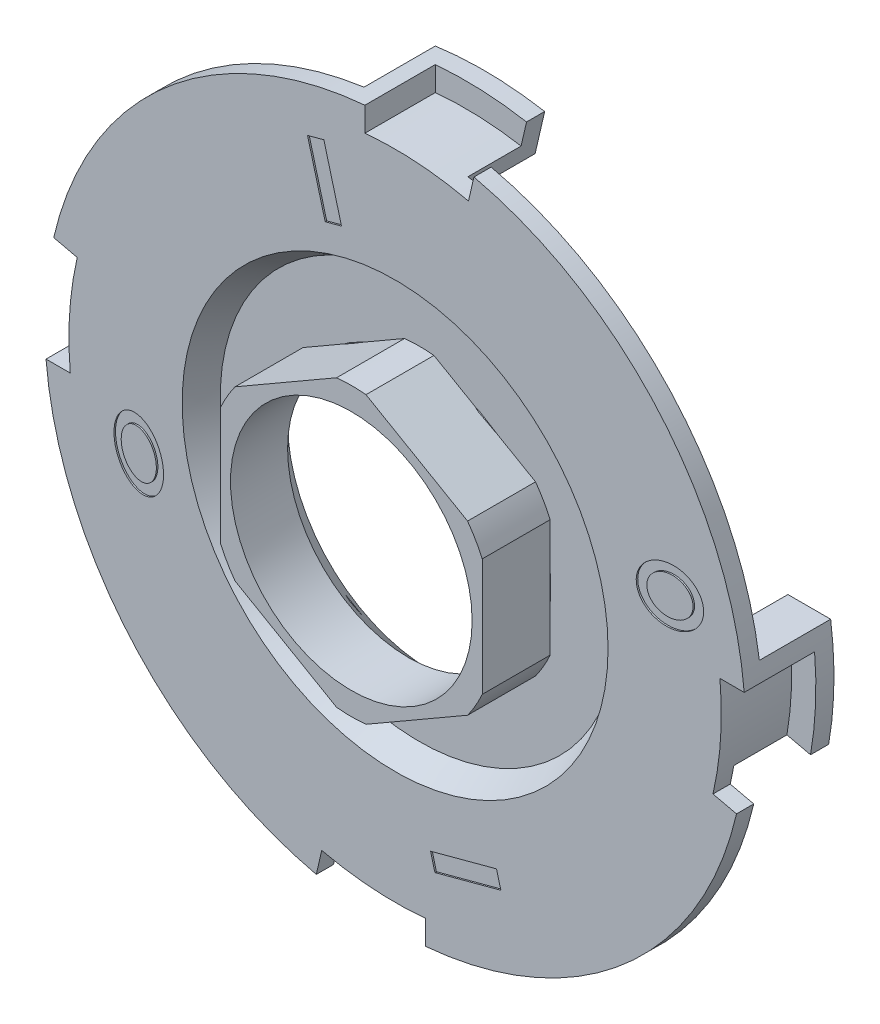
from build123d import *

# Parameters (mm, degrees)
SKETCH1_R           = 29.464
BASE_EXTRUDE_DEPTH  = 1.4478
SKETCH2_R           = 18.5674
BOSS_EXTRUDE1_DEPTH = 1.5748
FILLET1_R           = 1.5748
SKETCH3_R           = 17.907
CUT_EXTRUDE1_DEPTH  = 2.032
CUT_EXTRUDE1_DRAFT  = -30
BOSS_EXTRUDE2_DEPTH = 5.715
CUT_EXTRUDE2_START  = -5.715
CUT_EXTRUDE2_DEPTH  = 5.715
SKETCH6_R           = 10.16
CUT_EXTRUDE3_DEPTH  = 43.204498141
CUT_EXTRUDE4_DEPTH  = 42.983088269
CIRPATTERN1_COUNT   = 4
BOSS_EXTRUDE3_DEPTH = 5.9944
CUT_EXTRUDE5_DEPTH  = 4.4704
CIRPATTERN2_COUNT   = 4
CUT_EXTRUDE6_DEPTH  = 0.127
CUT_EXTRUDE7_DEPTH  = 0.127
SKETCH13_RX         = 2.8702
SKETCH13_RY         = 2.315943611
SKETCH13_RX_2       = 1.966975065
SKETCH13_RY_2       = 1.574218937
SKETCH13_RY_3       = 2.01509994
SKETCH13_RX_3       = 1.966974984
SKETCH13_RY_4       = 1.436201162
CUT_EXTRUDE8_DEPTH  = 0.127
CHAMFER1_SIZE       = 1.905


# Read off the part's stored shape, not the designer's step: Cut-Extrude2
with BuildPart() as part:
    # Sketch1 → Base-Extrude (new body)
    with BuildSketch(Plane.XY):
        Circle(SKETCH1_R)
    extrude(amount=-BASE_EXTRUDE_DEPTH)

    # Sketch2 → Boss-Extrude1 (add)
    with BuildSketch(Plane(origin=(0, 0, -1.4478), x_dir=(-1, 0, 0), z_dir=(0, 0, -1))):
        with Locations(Location((0, 0, 0), (0, 0, 180))):
            Circle(SKETCH2_R)
    extrude(amount=BOSS_EXTRUDE1_DEPTH)

    # Fillet1
    fillet1_edges = [part.edges().sort_by_distance(p)[0] for p in [
        (-18.5674, 0, -3.0226),
    ]]
    fillet(fillet1_edges, radius=FILLET1_R - 0.0001)  # a hair under: the kernel refuses the full size


with BuildPart() as cut_extrude1_tool:
    # Sketch3 → Cut-Extrude1 (with draft: the straight prism first)
    with BuildSketch(Plane.XY):
        Circle(SKETCH3_R)
    extrude(amount=-CUT_EXTRUDE1_DEPTH)
    # Cut-Extrude1: the draft: its side faces are tilted about the plane it starts from
    cut_extrude1_sides = [cut_extrude1_tool.faces().sort_by_distance(p)[0] for p in [
        (-17.907, 0, -1.016),
    ]]
    draft(cut_extrude1_sides, Plane.XY, CUT_EXTRUDE1_DRAFT)


with BuildPart() as part_1:
    add(part.part)

    # Cut-Extrude1: cut by cut_extrude1_tool
    add(cut_extrude1_tool.part, mode=Mode.SUBTRACT)

    # Sketch4 → Boss-Extrude2 (add)
    with BuildSketch(Plane.XY.offset(-2.032)):
        Polygon((0, 12.714292158), (-11.0109, 6.357146079), (-11.0109, -6.357146079), (0, -12.714292158), (11.0109, -6.357146079), (11.0109, 6.357146079), align=None)
    extrude(amount=BOSS_EXTRUDE2_DEPTH)

    # Cut-Extrude2 outline → Cut-Extrude2 (cut)
    with BuildSketch(Plane.XY.offset(3.683).offset(CUT_EXTRUDE2_START)):
        with BuildLine():
            ThreePointArc((-11.0109, 4.931967781), (-10.448596497, 6.0325), (-9.776659389, 7.069735228))
            Line((-9.776659389, 7.069735228), (-11.0109, 6.357146079))
            Line((-11.0109, 6.357146079), (-11.0109, 4.931967781))
        make_face()
        with BuildLine():
            Line((0, 12.714292158), (-1.234240611, 12.001703009))
            ThreePointArc((-1.234240611, 12.001703009), (0, 12.065), (1.234240611, 12.001703009))
            Line((1.234240611, 12.001703009), (0, 12.714292158))
        make_face()
        with BuildLine():
            ThreePointArc((-9.776659389, -7.069735228), (-10.448596497, -6.0325), (-11.0109, -4.931967781))
            Line((-11.0109, -4.931967781), (-11.0109, -6.357146079))
            Line((-11.0109, -6.357146079), (-9.776659389, -7.069735228))
        make_face()
        with BuildLine():
            Line((11.0109, 6.357146079), (9.776659389, 7.069735228))
            ThreePointArc((9.776659389, 7.069735228), (10.448596497, 6.0325), (11.0109, 4.931967781))
            Line((11.0109, 4.931967781), (11.0109, 6.357146079))
        make_face()
        with BuildLine():
            ThreePointArc((1.234240611, -12.001703009), (0, -12.065), (-1.234240611, -12.001703009))
            Line((-1.234240611, -12.001703009), (0, -12.714292158))
            Line((0, -12.714292158), (1.234240611, -12.001703009))
        make_face()
        with BuildLine():
            Line((11.0109, -6.357146079), (11.0109, -4.931967781))
            ThreePointArc((11.0109, -4.931967781), (10.448596497, -6.0325), (9.776659389, -7.069735228))
            Line((9.776659389, -7.069735228), (11.0109, -6.357146079))
        make_face()
    extrude(amount=CUT_EXTRUDE2_DEPTH, mode=Mode.SUBTRACT)

    # Sketch6 → Cut-Extrude3 (cut, through all)
    with BuildSketch(Plane.XY.offset(3.683)):
        Circle(SKETCH6_R)
    extrude(amount=-CUT_EXTRUDE3_DEPTH, mode=Mode.SUBTRACT)

    # Sketch8 → Cut-Extrude4 (cut, through all)
    with BuildSketch(Plane(origin=(0, 0, -1.4478), x_dir=(-1, 0, 0), z_dir=(0, 0, -1))):
        with BuildLine():
            Line((2.54, 29.354313073), (2.54, 27.314154279))
            ThreePointArc((2.54, 27.314154279), (-1.838860007, 27.370298096), (-6.170857323, 26.728919617))
            Line((-6.170857323, 26.728919617), (-6.627957865, 28.708839589))
            ThreePointArc((-6.627957865, 28.708839589), (-2.069301544, 29.391245076), (2.54, 29.354313073))
        make_face()
    cut_extrude4 = extrude(amount=-CUT_EXTRUDE4_DEPTH, mode=Mode.SUBTRACT)

    # CirPattern1: Cut-Extrude4 ×4 about axis
    cirpattern1_axis = Axis((0, 0, 0), (0, 0, 1))
    for i in range(1, CIRPATTERN1_COUNT):
        add(cut_extrude4.rotate(cirpattern1_axis, i * 360 / CIRPATTERN1_COUNT), mode=Mode.SUBTRACT)

    # Sketch9 → Boss-Extrude3 (add)
    with BuildSketch(Plane(origin=(0, 0, -1.4478), x_dir=(-1, 0, 0), z_dir=(0, 0, -1))):
        with BuildLine():
            Line((4.064, 25.587269647), (4.064, 29.182378244))
            ThreePointArc((4.064, 29.182378244), (-0.541715145, 29.459019683), (-5.134145774, 29.013235655))
            Line((-5.134145774, 29.013235655), (-4.333000099, 25.543092494))
            ThreePointArc((-4.333000099, 25.543092494), (-0.136301756, 25.907641456), (4.064, 25.587269647))
        make_face()
    boss_extrude3 = extrude(amount=BOSS_EXTRUDE3_DEPTH)

    # Sketch10 → Cut-Extrude5 (cut)
    with BuildSketch(Plane.XY.offset(-1.4478)):
        with BuildLine():
            Line((5.134145774, 29.013235655), (4.676387057, 27.030464815))
            ThreePointArc((4.676387057, 27.030464815), (1.07757011, 27.410827544), (-2.54, 27.314154279))
            Line((-2.54, 27.314154279), (-2.54, 29.354313073))
            ThreePointArc((-2.54, 29.354313073), (1.308236036, 29.434942067), (5.134145774, 29.013235655))
        make_face()
    cut_extrude5 = extrude(amount=-CUT_EXTRUDE5_DEPTH, mode=Mode.SUBTRACT)

    # CirPattern2: Boss-Extrude3, Cut-Extrude5 ×4 about axis
    cirpattern2_axis = Axis((0, 0, 0), (0, 0, 1))
    add([boss_extrude3.rotate(cirpattern2_axis, i * 360 / CIRPATTERN2_COUNT) for i in range(1, CIRPATTERN2_COUNT)])
    add([cut_extrude5.rotate(cirpattern2_axis, i * 360 / CIRPATTERN2_COUNT) for i in range(1, CIRPATTERN2_COUNT)], mode=Mode.SUBTRACT)

    # Sketch11 → Cut-Extrude6 (cut)
    with BuildSketch(Plane.XY):
        Polygon((-7.366154253, 24.742996139), (-5.880429407, 19.198195525), (-4.506496511, 19.566339735), (-5.992221358, 25.111140348), align=None)
    extrude(amount=-CUT_EXTRUDE6_DEPTH, mode=Mode.SUBTRACT)

    # Sketch12 → Cut-Extrude7 (cut)
    with BuildSketch(Plane.XY):
        Polygon((2.979852971, -22.210563913), (8.524653584, -20.724839066), (8.892797794, -22.098771961), (3.347997181, -23.584496808), align=None)
    extrude(amount=-CUT_EXTRUDE7_DEPTH, mode=Mode.SUBTRACT)

    # Sketch13 → Cut-Extrude8 (cut)
    # profile 1 of 2: a face of its own
    with BuildSketch(Plane.XY):
        with Locations(Location((23.11032284, 6.450896771), (0, 0, -165))):
            Ellipse(SKETCH13_RX, SKETCH13_RY)
        with Locations(Location((23.11032284, 6.450896771), (0, 0, -165))):
            Ellipse(SKETCH13_RX_2, SKETCH13_RY_2, mode=Mode.SUBTRACT)
    # profile 2 of 2: a face of its own
    with BuildSketch(Plane.XY):
        with Locations(Location((-21.554852577, -5.517100911), (0, 0, -75))):
            Ellipse(SKETCH13_RX, SKETCH13_RY_3)
        with Locations(Location((-21.554852577, -5.517100911), (0, 0, -75))):
            Ellipse(SKETCH13_RX_3, SKETCH13_RY_4, mode=Mode.SUBTRACT)
    extrude(amount=-CUT_EXTRUDE8_DEPTH, mode=Mode.SUBTRACT)

    # Chamfer1
    chamfer1_edges = [part_1.edges().sort_by_distance(p)[0] for p in [
        (-10.16, 0, -3.0226),
    ]]
    chamfer(chamfer1_edges, length=CHAMFER1_SIZE)


solid = part_1.part
